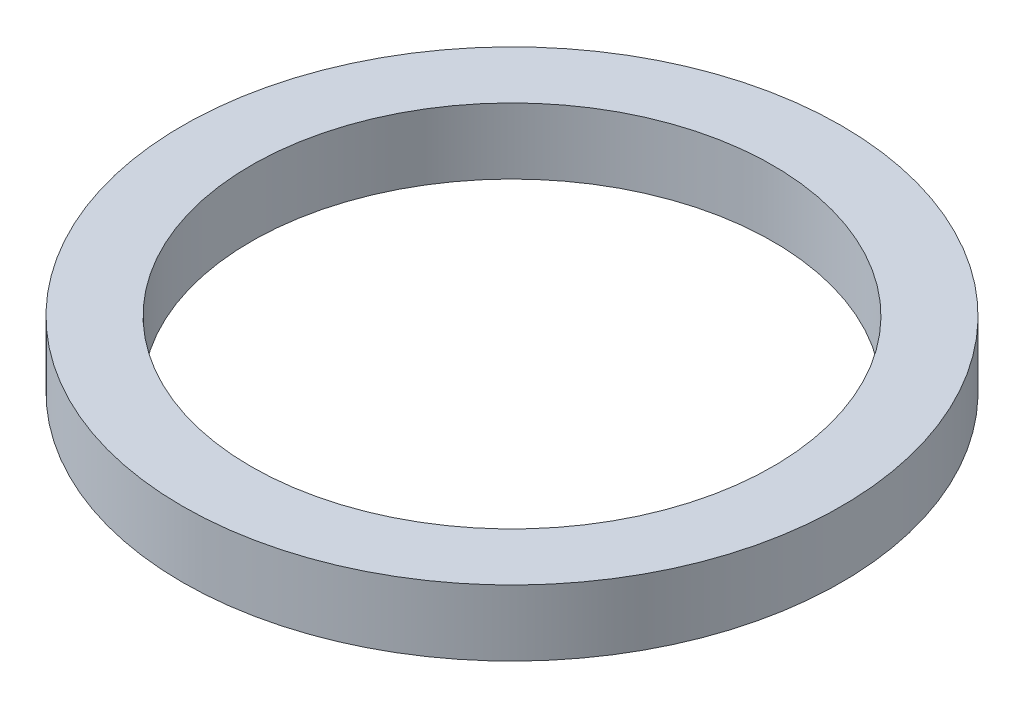
from build123d import *

# Parameters (mm, degrees)
SKETCH1_R           = 60
BOSS_EXTRUDE1_DEPTH = 12
SKETCH2_R           = 47.5
CUT_EXTRUDE1_DEPTH  = 86.697141143


with BuildPart() as part:
    # Sketch1 → Boss-Extrude1 (new body)
    with BuildSketch(Plane(origin=(0, 0, 0), x_dir=(1, 0, 0), z_dir=(0, 1, 0))):
        Circle(SKETCH1_R)
    extrude(amount=BOSS_EXTRUDE1_DEPTH)

    # Sketch2 → Cut-Extrude1 (cut, through all)
    with BuildSketch(Plane(origin=(0, 0, 0), x_dir=(1, 0, 0), z_dir=(0, 1, 0))):
        Circle(SKETCH2_R)
    extrude(amount=CUT_EXTRUDE1_DEPTH, mode=Mode.SUBTRACT)


solid = part.part
